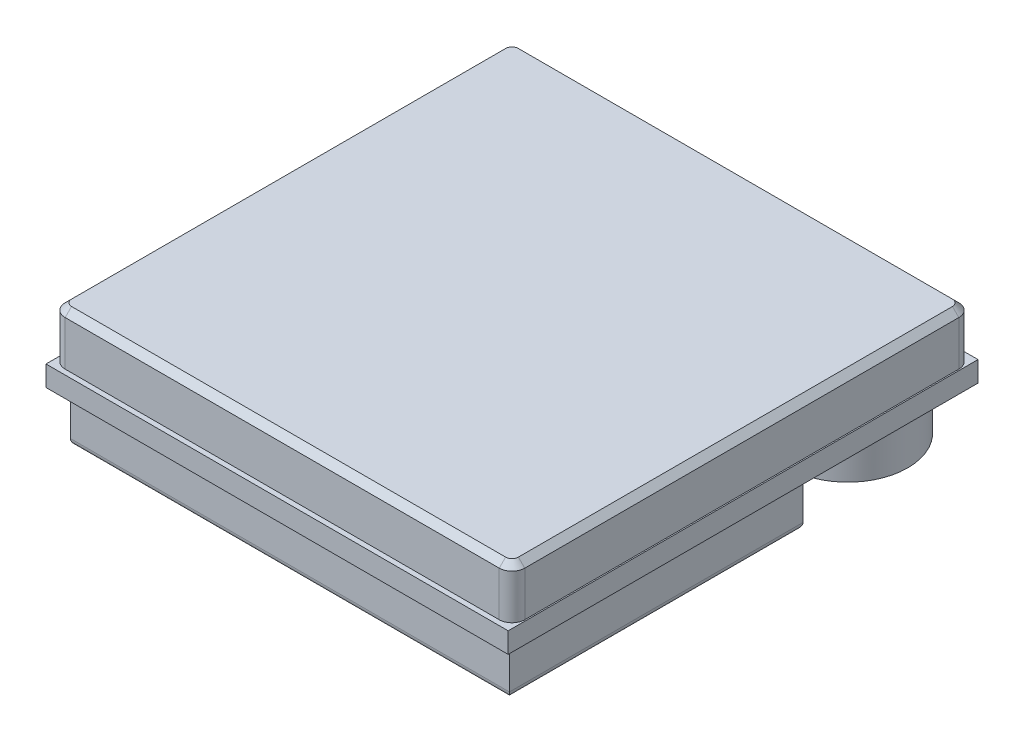
from build123d import *

# Parameters (mm, degrees)
SKETCH1_W           = 18.1
SKETCH1_H           = 18.4
BOSS_EXTRUDE1_DEPTH = 0.4
SKETCH2_W           = 18
SKETCH2_H           = 18
BOSS_EXTRUDE2_DEPTH = 2
SKETCH3_W           = 6.15
SKETCH3_H           = 4.3
BOSS_EXTRUDE3_DEPTH = 3
SKETCH4_W           = 5.15
SKETCH4_H           = 2
CUT_EXTRUDE1_DEPTH  = 3.5
SKETCH5_W           = 17.2
SKETCH5_H           = 11.5
BOSS_EXTRUDE4_DEPTH = 2
FILLET1_R           = 0.25
BOSS_EXTRUDE5_DEPTH = 1.7
FILLET2_R           = 0.5
CHAMFER1_SIZE       = 0.25


with BuildPart() as part:
    # Sketch1 → Boss-Extrude1 (new, symmetric)
    with BuildSketch(Plane(origin=(0, 0, 0), x_dir=(1, 0, 0), z_dir=(0, 1, 0))):
        Rectangle(SKETCH1_W, SKETCH1_H)
    extrude(amount=BOSS_EXTRUDE1_DEPTH, both=True)

    # Sketch2 → Boss-Extrude2 (add)
    with BuildSketch(Plane(origin=(0, 0.4, 0), x_dir=(1, 0, 0), z_dir=(0, 1, 0))):
        Rectangle(SKETCH2_W, SKETCH2_H)
    extrude(amount=BOSS_EXTRUDE2_DEPTH)

    # Sketch3 → Boss-Extrude3 (add)
    with BuildSketch(Plane.XZ.offset(0.4)):
        with Locations((0, -6.55)):
            Rectangle(SKETCH3_W, SKETCH3_H)
    extrude(amount=BOSS_EXTRUDE3_DEPTH)

    # Sketch4 → Cut-Extrude1 (cut)
    with BuildSketch(Plane(origin=(0, 0, -8.7), x_dir=(-1, 0, 0), z_dir=(0, 0, -1))):
        with Locations((0, -1.9)):
            Rectangle(SKETCH4_W, SKETCH4_H)
    extrude(amount=-CUT_EXTRUDE1_DEPTH, mode=Mode.SUBTRACT)

    # Sketch5 → Boss-Extrude4 (add)
    with BuildSketch(Plane.XZ.offset(0.4)):
        with Locations((0, 2.95)):
            Rectangle(SKETCH5_W, SKETCH5_H)
    extrude(amount=BOSS_EXTRUDE4_DEPTH)

    # Fillet1
    fillet1_edges = [part.edges().sort_by_distance(p)[0] for p in [
        (0, -2.4, -2.8),
        (-8.6, -2.4, 2.95),
        (0, -2.4, 8.7),
        (8.6, -2.4, 2.95),
    ]]
    fillet(fillet1_edges, radius=FILLET1_R)

    # Sketch6 → Boss-Extrude5 (add)
    with BuildSketch(Plane.XZ.offset(0.4)):
        with BuildLine():
            ThreePointArc((6.5, -9), (8.161700936, -8.311700936), (8.85, -6.65))
            ThreePointArc((8.85, -6.65), (4.838299064, -4.988299064), (6.5, -9))
        make_face()
    extrude(amount=BOSS_EXTRUDE5_DEPTH)

    # Fillet2
    fillet2_edges = [part.edges().sort_by_distance(p)[0] for p in [
        (-9, 1.4, -9),
        (-9, 1.4, 9),
        (9, 1.4, 9),
        (9, 1.4, -9),
    ]]
    fillet(fillet2_edges, radius=FILLET2_R)

    # Chamfer1
    chamfer1_edges = [part.edges().sort_by_distance(p)[0] for p in [
        (9, 2.4, 0),
        (8.853553391, 2.4, -8.853553391),
        (8.853553391, 2.4, 8.853553391),
        (0, 2.4, -9),
        (0, 2.4, 9),
        (-8.853553391, 2.4, -8.853553391),
        (-8.853553391, 2.4, 8.853553391),
        (-9, 2.4, 0),
    ]]
    chamfer(chamfer1_edges, length=CHAMFER1_SIZE)


solid = part.part
